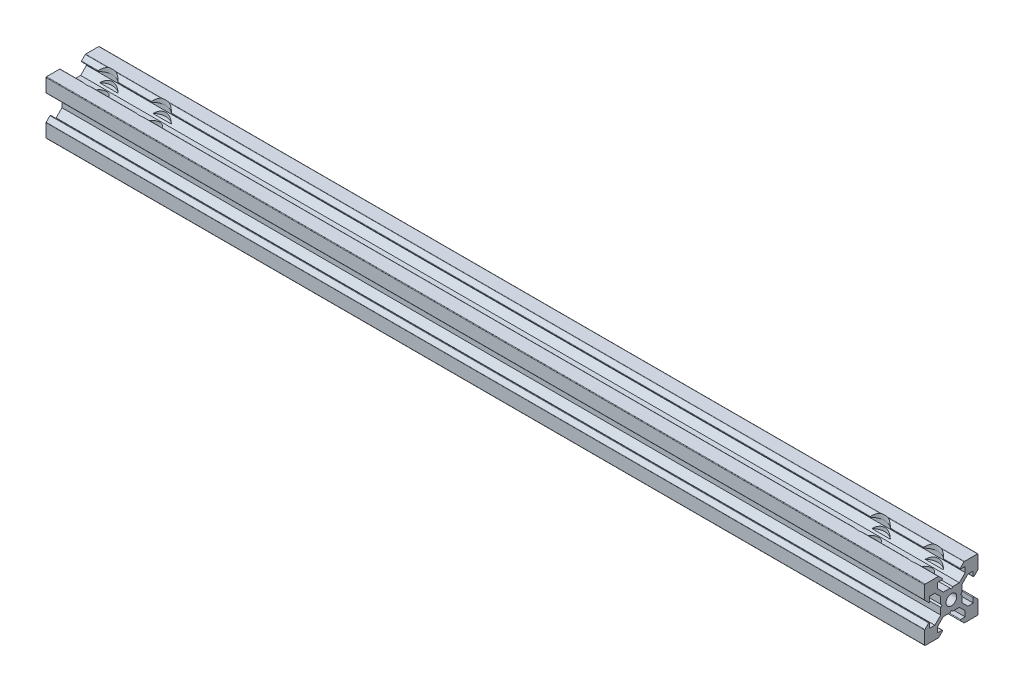
from build123d import *

# Parameters (mm, degrees)
SKIZZE1_R                                            = 2
AUFSATZ_LINEAR_AUSTRAGEN1_DEPTH                      = 345
SCHNITT_LINEAR_AUSTRAGEN1_DEPTH                      = 346.289733412
SCHNITT_LINEAR_AUSTRAGEN1_DEPTH_BACK                 = 346.289733412
SKIZZE2_W                                            = 15
SKIZZE2_H                                            = 20
STIRNSENKUNG_F_R_M5_ZYLINDERSCHRAUBE_MIT_D           = 5.3
STIRNSENKUNG_F_R_M5_ZYLINDERSCHRAUBE_MIT_CBORE_D     = 10
STIRNSENKUNG_F_R_M5_ZYLINDERSCHRAUBE_MIT_CBORE_DEPTH = 5.4


# Read off the part's stored shape, not the designer's step: Importiert1
with BuildPart() as part:
    # Skizze1 → Aufsatz-Linear austragen1 (new body)
    with BuildSketch(Plane.ZY):
        with BuildLine():
            Line((-4, 0.5), (-3.5, 0))
            Line((-3.5, 0), (-4, -0.5))
            Line((-4, -0.5), (-4, -3.010050506))
            Line((-4, -3.010050506), (-6.2, -5.210050506))
            Line((-6.2, -5.210050506), (-8.2, -5.210050506))
            Line((-8.2, -5.210050506), (-8.2, -3.482842712))
            ThreePointArc((-8.2, -3.482842712), (-8.323463314, -3.298066806), (-8.541421356, -3.341421356))
            Line((-8.541421356, -3.341421356), (-9.941421356, -4.741421356))
            ThreePointArc((-9.941421356, -4.741421356), (-9.984775907, -4.806306026), (-10, -4.882842712))
            Line((-10, -4.882842712), (-10, -9.8))
            ThreePointArc((-10, -9.8), (-9.941421356, -9.941421356), (-9.8, -10))
            Line((-9.8, -10), (-4.882842712, -10))
            ThreePointArc((-4.882842712, -10), (-4.806306026, -9.984775907), (-4.741421356, -9.941421356))
            Line((-4.741421356, -9.941421356), (-3.341421356, -8.541421356))
            ThreePointArc((-3.341421356, -8.541421356), (-3.298066806, -8.323463314), (-3.482842712, -8.2))
            Line((-3.482842712, -8.2), (-5.210050506, -8.2))
            Line((-5.210050506, -8.2), (-5.210050506, -6.2))
            Line((-5.210050506, -6.2), (-3.010050506, -4))
            Line((-3.010050506, -4), (-0.5, -4))
            Line((-0.5, -4), (0, -3.5))
            Line((0, -3.5), (0.5, -4))
            Line((0.5, -4), (3.010050506, -4))
            Line((3.010050506, -4), (5.210050506, -6.2))
            Line((5.210050506, -6.2), (5.210050506, -8.2))
            Line((5.210050506, -8.2), (3.482842712, -8.2))
            ThreePointArc((3.482842712, -8.2), (3.298066806, -8.323463314), (3.341421356, -8.541421356))
            Line((3.341421356, -8.541421356), (4.741421356, -9.941421356))
            ThreePointArc((4.741421356, -9.941421356), (4.806306026, -9.984775907), (4.882842712, -10))
            Line((4.882842712, -10), (9.8, -10))
            ThreePointArc((9.8, -10), (9.941421356, -9.941421356), (10, -9.8))
            Line((10, -9.8), (10, -4.882842712))
            ThreePointArc((10, -4.882842712), (9.984775907, -4.806306026), (9.941421356, -4.741421356))
            Line((9.941421356, -4.741421356), (8.541421356, -3.341421356))
            ThreePointArc((8.541421356, -3.341421356), (8.323463314, -3.298066806), (8.2, -3.482842712))
            Line((8.2, -3.482842712), (8.2, -5.210050506))
            Line((8.2, -5.210050506), (6.2, -5.210050506))
            Line((6.2, -5.210050506), (4, -3.010050506))
            Line((4, -3.010050506), (4, -0.5))
            Line((4, -0.5), (3.5, 0))
            Line((3.5, 0), (4, 0.5))
            Line((4, 0.5), (4, 3.010050506))
            Line((4, 3.010050506), (6.2, 5.210050506))
            Line((6.2, 5.210050506), (8.2, 5.210050506))
            Line((8.2, 5.210050506), (8.2, 3.482842712))
            ThreePointArc((8.2, 3.482842712), (8.323463314, 3.298066806), (8.541421356, 3.341421356))
            Line((8.541421356, 3.341421356), (9.941421356, 4.741421356))
            ThreePointArc((9.941421356, 4.741421356), (9.984775907, 4.806306026), (10, 4.882842712))
            Line((10, 4.882842712), (10, 9.8))
            ThreePointArc((10, 9.8), (9.941421356, 9.941421356), (9.8, 10))
            Line((9.8, 10), (4.882842712, 10))
            ThreePointArc((4.882842712, 10), (4.806306026, 9.984775907), (4.741421356, 9.941421356))
            Line((4.741421356, 9.941421356), (3.341421356, 8.541421356))
            ThreePointArc((3.341421356, 8.541421356), (3.298066806, 8.323463314), (3.482842712, 8.2))
            Line((3.482842712, 8.2), (5.210050506, 8.2))
            Line((5.210050506, 8.2), (5.210050506, 6.2))
            Line((5.210050506, 6.2), (3.010050506, 4))
            Line((3.010050506, 4), (0.5, 4))
            Line((0.5, 4), (0, 3.5))
            Line((0, 3.5), (-0.5, 4))
            Line((-0.5, 4), (-3.010050506, 4))
            Line((-3.010050506, 4), (-5.210050506, 6.2))
            Line((-5.210050506, 6.2), (-5.210050506, 8.2))
            Line((-5.210050506, 8.2), (-3.482842712, 8.2))
            ThreePointArc((-3.482842712, 8.2), (-3.298066806, 8.323463314), (-3.341421356, 8.541421356))
            Line((-3.341421356, 8.541421356), (-4.741421356, 9.941421356))
            ThreePointArc((-4.741421356, 9.941421356), (-4.806306026, 9.984775907), (-4.882842712, 10))
            Line((-4.882842712, 10), (-9.8, 10))
            ThreePointArc((-9.8, 10), (-9.941421356, 9.941421356), (-10, 9.8))
            Line((-10, 9.8), (-10, 4.882842712))
            ThreePointArc((-10, 4.882842712), (-9.984775907, 4.806306026), (-9.941421356, 4.741421356))
            Line((-9.941421356, 4.741421356), (-8.541421356, 3.341421356))
            ThreePointArc((-8.541421356, 3.341421356), (-8.323463314, 3.298066806), (-8.2, 3.482842712))
            Line((-8.2, 3.482842712), (-8.2, 5.210050506))
            Line((-8.2, 5.210050506), (-6.2, 5.210050506))
            Line((-6.2, 5.210050506), (-4, 3.010050506))
            Line((-4, 3.010050506), (-4, 0.5))
        make_face()
        Circle(SKIZZE1_R, mode=Mode.SUBTRACT)
    extrude(amount=-AUFSATZ_LINEAR_AUSTRAGEN1_DEPTH)

    # Skizze2 → Schnitt-Linear austragen1 (cut, two sides: drawn at the far end of the back side and taken through both)
    with BuildSketch(Plane.XY.offset(-SCHNITT_LINEAR_AUSTRAGEN1_DEPTH_BACK)):
        with Locations((337.5, 0)):
            Rectangle(SKIZZE2_W, SKIZZE2_H)
    extrude(amount=SCHNITT_LINEAR_AUSTRAGEN1_DEPTH + SCHNITT_LINEAR_AUSTRAGEN1_DEPTH_BACK, mode=Mode.SUBTRACT)

    # Stirnsenkung für M5 Zylinderschraube mit Innensechskant1 (through all)
    with Locations(Plane(origin=(0, 10, 0), x_dir=(1, 0, 0), z_dir=(0, 1, 0))):
        with Locations((10, 0), (30, 0), (300, 0), (320, 0)):
            CounterBoreHole(STIRNSENKUNG_F_R_M5_ZYLINDERSCHRAUBE_MIT_D / 2, STIRNSENKUNG_F_R_M5_ZYLINDERSCHRAUBE_MIT_CBORE_D / 2, STIRNSENKUNG_F_R_M5_ZYLINDERSCHRAUBE_MIT_CBORE_DEPTH)


solid = part.part
